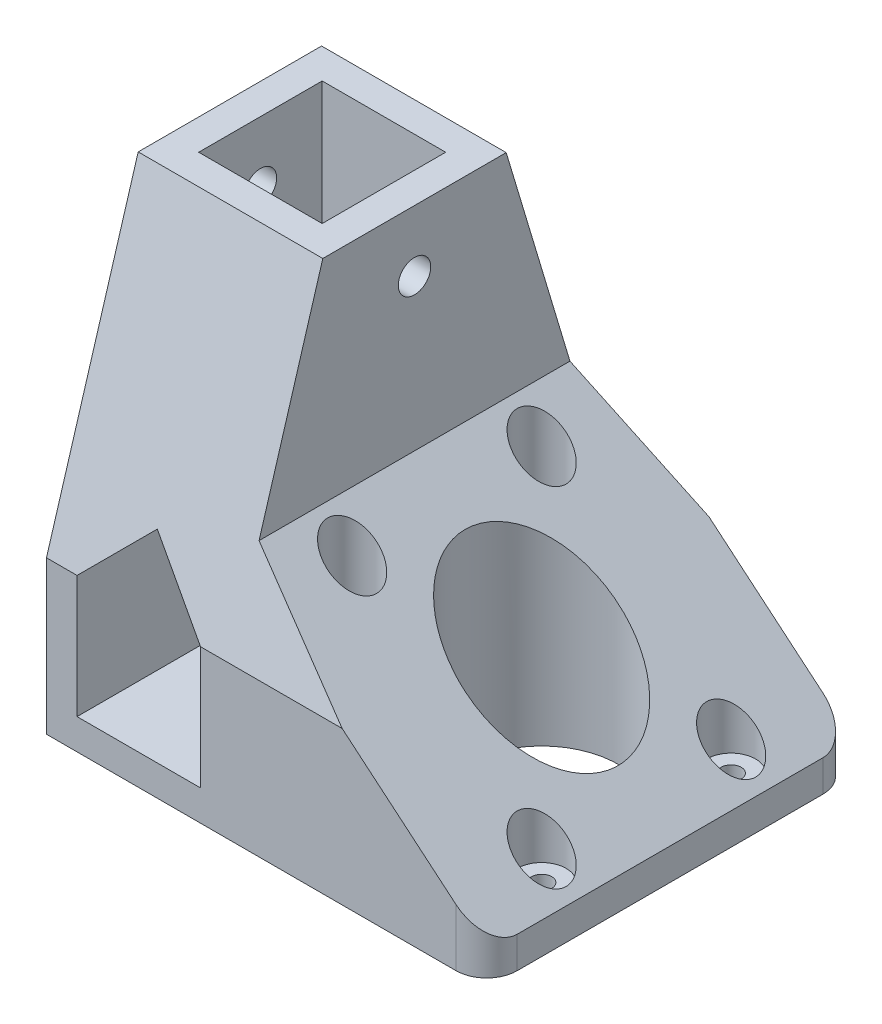
from build123d import *

# Parameters (mm, degrees)
SKETCH1_W               = 72
SKETCH1_H               = 60
BOSS_EXTRUDE1_DEPTH     = 5
SKETCH2_W               = 5
SKETCH2_H               = 60
BOSS_EXTRUDE2_DEPTH     = 70
SKETCH3_W               = 5
SKETCH3_H               = 60
BOSS_EXTRUDE3_DEPTH     = 70
BOSS_EXTRUDE4_DEPTH     = 60
CHAMFER1_SIZE           = 42
CHAMFER1_SIZE_2         = 35.242184509
CHAMFER2_SIZE           = 15.000718891
CHAMFER2_SIZE_2         = 50
SKETCH12_W              = 20.2
SKETCH12_H              = 20.2
CUT_EXTRUDE8_DEPTH      = 67
CUT_EXTRUDE1_DEPTH      = 117.978630527
CUT_EXTRUDE1_DEPTH_BACK = 117.978630527
SKETCH5_R               = 12.5
SKETCH6_R               = 1.65
CUT_EXTRUDE2_DEPTH      = 121.037494142
SKETCH7_R               = 4
CUT_EXTRUDE4_DEPTH      = 117.978630527
CUT_EXTRUDE5_DEPTH      = 105.748460609
CUT_EXTRUDE5_DEPTH_BACK = 105.748460609
SKETCH8_R               = 2.65
CUT_EXTRUDE6_DEPTH      = 121.037494142
CUT_EXTRUDE6_DEPTH_BACK = 121.037494142
SKETCH9_R               = 2.65
FILLET1_R               = 5
SKETCH10_R              = 2.65
CUT_EXTRUDE7_DEPTH      = 10


with BuildPart() as part:
    # Sketch1 → Boss-Extrude1 (new body)
    with BuildSketch(Plane(origin=(0, 0, 0), x_dir=(1, 0, 0), z_dir=(0, 1, 0))):
        with Locations((36, 30)):
            Rectangle(SKETCH1_W, SKETCH1_H)
    extrude(amount=BOSS_EXTRUDE1_DEPTH)

    # Sketch2 → Boss-Extrude2 (add)
    with BuildSketch(Plane(origin=(0, 5, 0), x_dir=(1, 0, 0), z_dir=(0, 1, 0))):
        with Locations((2.5, 30)):
            Rectangle(SKETCH2_W, SKETCH2_H)
    extrude(amount=BOSS_EXTRUDE2_DEPTH)

    # Sketch3 → Boss-Extrude3 (add)
    with BuildSketch(Plane(origin=(0, 5, 0), x_dir=(1, 0, 0), z_dir=(0, 1, 0))):
        with Locations((27.7, 30)):
            Rectangle(SKETCH3_W, SKETCH3_H)
    extrude(amount=BOSS_EXTRUDE3_DEPTH)

    # Sketch11 → Boss-Extrude4 (add)
    with BuildSketch(Plane(origin=(0, 0, -60), x_dir=(-1, 0, 0), z_dir=(0, 0, -1))):
        Polygon((-25.2, 25), (-15.1, 35.1), (-5, 25), (-5, 75), (-25.2, 75), align=None)
    extrude(amount=-BOSS_EXTRUDE4_DEPTH)

    # Chamfer1
    # the kernel refuses this chamfer: 42, 35.242184509 mm, written as the material it adds along each edge
    with BuildSketch(Plane(origin=(30.2, 5, -60), x_dir=(0.9996889667359942, -0.02493932209023436, 0), z_dir=(0, 0, 1))) as chamfer1_piece_1_section:
        Polygon((CHAMFER1_SIZE * 0.999688966736, CHAMFER1_SIZE * 0.0249393220902), (-CHAMFER1_SIZE_2 * 0.0249393220905, CHAMFER1_SIZE_2 * 0.999688966749), (0, 0), align=None)
    chamfer1_piece_1 = extrude(amount=60, mode=Mode.PRIVATE)
    chamfer1_piece_1 = split(chamfer1_piece_1, bisect_by=Plane(origin=(72, 16.573415306, -30), z_dir=(-1, 0, 0)), keep=Keep.TOP, mode=Mode.PRIVATE)
    add(chamfer1_piece_1)

    # Chamfer2
    # the kernel refuses this chamfer: 50, 15.000718891 mm, written as the material it takes off along each edge
    with BuildSketch(Plane(origin=(159.997065138, 75, -60), x_dir=(0, 0.12207157319780576, 0.9925213000318999), z_dir=(-1, 0, 0))) as chamfer2_piece_1:
        Polygon((CHAMFER2_SIZE * 0.99252130002, -CHAMFER2_SIZE * 0.122071573196), (-CHAMFER2_SIZE_2 * 0.122071573198, -CHAMFER2_SIZE_2 * 0.992521300032), (0, 0), align=None)
    extrude(amount=289.794130277, mode=Mode.SUBTRACT)
    with BuildSketch(Plane(origin=(159.997065138, 75, 0), x_dir=(0, 0.12207157319780576, -0.9925213000318999), z_dir=(-1, 0, 0))) as chamfer2_piece_2:
        Polygon((CHAMFER2_SIZE * 0.99252130002, CHAMFER2_SIZE * 0.122071573196), (-CHAMFER2_SIZE_2 * 0.122071573198, CHAMFER2_SIZE_2 * 0.992521300032), (0, 0), align=None)
    extrude(amount=289.794130277, mode=Mode.SUBTRACT)

    # Sketch12 → Cut-Extrude8 (cut)
    with BuildSketch(Plane(origin=(0, 75, 0), x_dir=(1, 0, 0), z_dir=(0, 1, 0))):
        with Locations((15.1, 30)):
            Rectangle(SKETCH12_W, SKETCH12_H)
    extrude(amount=-CUT_EXTRUDE8_DEPTH, mode=Mode.SUBTRACT)

    # Sketch5 → Cut-Extrude1 (cut, two sides: drawn at the far end of the back side and taken through both)
    with BuildSketch(Plane(origin=(0, 5, 0), x_dir=(1, 0, 0), z_dir=(0, 1, 0)).offset(-CUT_EXTRUDE1_DEPTH_BACK)):
        with Locations(Location((51, 30, 0), (0, 0, 270))):
            Circle(SKETCH5_R)
    extrude(amount=CUT_EXTRUDE1_DEPTH + CUT_EXTRUDE1_DEPTH_BACK, mode=Mode.SUBTRACT)

    # Sketch6 → Cut-Extrude2 (cut, through all)
    with BuildSketch(Plane.XZ):
        with Locations(Location((66.5, -14.5, 0), (0, 0, 270))):
            Circle(SKETCH6_R)
        with Locations(Location((66.5, -45.5, 0), (0, 0, 270))):
            Circle(SKETCH6_R)
        with Locations(Location((35.5, -45.5, 0), (0, 0, 270))):
            Circle(SKETCH6_R)
        with Locations(Location((35.5, -14.5, 0), (0, 0, 270))):
            Circle(SKETCH6_R)
    extrude(amount=-CUT_EXTRUDE2_DEPTH, mode=Mode.SUBTRACT)

    # Sketch7 → Cut-Extrude4 (cut, through all)
    with BuildSketch(Plane(origin=(0, 5, 0), x_dir=(1, 0, 0), z_dir=(0, 1, 0))):
        with Locations((66.5, 45.5)):
            Circle(SKETCH7_R)
        with Locations((66.5, 14.5)):
            Circle(SKETCH7_R)
        with Locations((35.5, 14.5)):
            Circle(SKETCH7_R)
        with Locations((35.5, 45.5)):
            Circle(SKETCH7_R)
    extrude(amount=CUT_EXTRUDE4_DEPTH, mode=Mode.SUBTRACT)

    # Sketch8 → Cut-Extrude5 (cut, two sides: drawn at the far end of the back side and taken through both)
    with BuildSketch(Plane(origin=(30.2, 0, 0), x_dir=(0, 0, -1), z_dir=(1, 0, 0)).offset(-CUT_EXTRUDE5_DEPTH_BACK)):
        with Locations((30, 65)):
            Circle(SKETCH8_R)
    extrude(amount=CUT_EXTRUDE5_DEPTH + CUT_EXTRUDE5_DEPTH_BACK, mode=Mode.SUBTRACT)

    # Sketch9 → Cut-Extrude6 (cut, two sides: drawn at the far end of the back side and taken through both)
    with BuildSketch(Plane.XZ.offset(-CUT_EXTRUDE6_DEPTH_BACK)):
        with Locations(Location((15, -30, 0), (0, 0, 270))):
            Circle(SKETCH9_R)
    extrude(amount=CUT_EXTRUDE6_DEPTH + CUT_EXTRUDE6_DEPTH_BACK, mode=Mode.SUBTRACT)

    # Fillet1
    fillet1_edges = [part.edges().sort_by_distance(p)[0] for p in [
        (72, 2.583909963, -60),
        (72, 2.583909963, 0),
    ]]
    fillet(fillet1_edges, radius=FILLET1_R)

    # Sketch10 → Cut-Extrude7 (cut)
    with BuildSketch(Plane.ZY):
        with Locations((-30, 15)):
            Circle(SKETCH10_R)
    extrude(amount=-CUT_EXTRUDE7_DEPTH, mode=Mode.SUBTRACT)


solid = part.part
